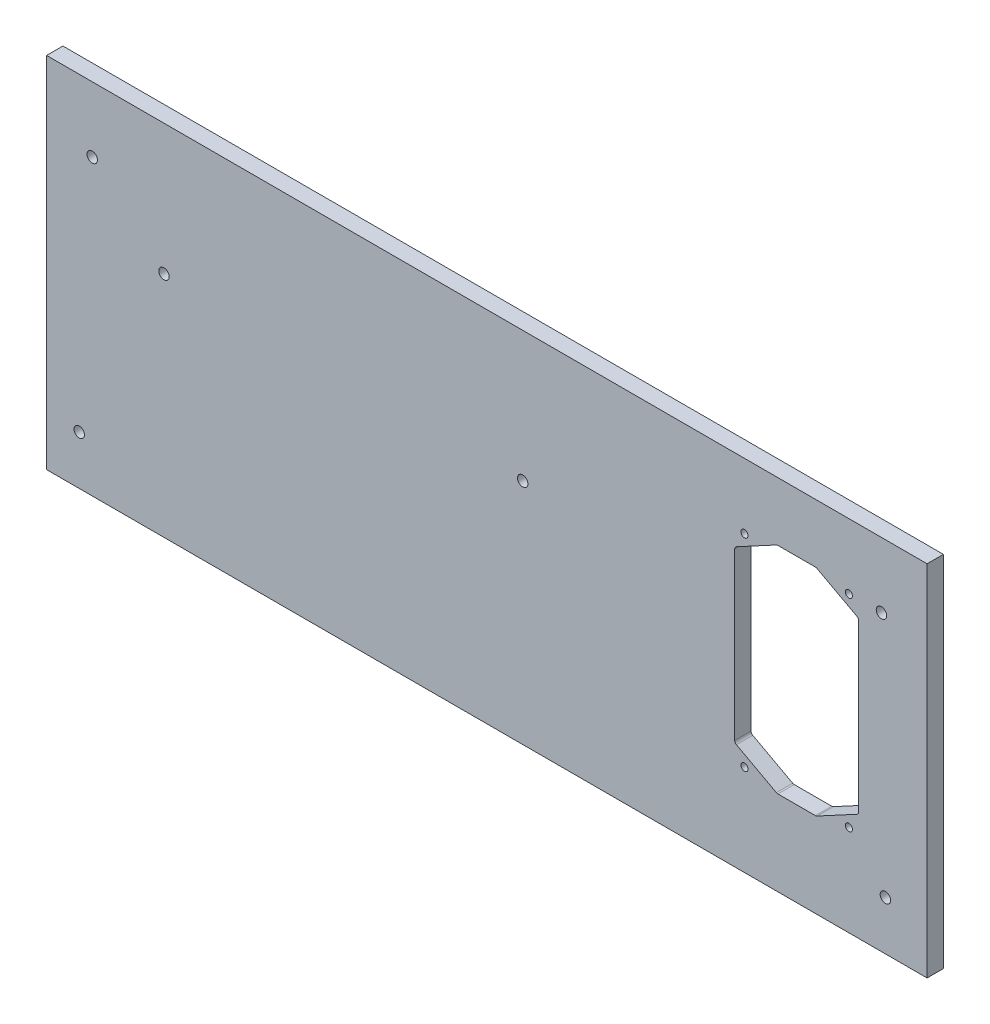
from build123d import *

# Parameters (mm, degrees)
SKETCH1_W                             = 270
SKETCH1_H                             = 110
SHEET_DEPTH                           = 2.5
SKETCH4_R                             = 1.1
CUT_EXTRUDE1_DEPTH                    = 146.859521458
FILLET1_R                             = 1
F_3_2_3_2_MOUNTHOLES_D                = 3.2
F_3_2_3_2_MOUNTHOLES_CSINK_D          = 6.5
F_3_2_3_2_MOUNTHOLES_CSINK_ANGLE      = 90
F_3_2_3_2_MIDDLEPARTHOLES_D           = 3.2
F_3_2_3_2_MIDDLEPARTHOLES_CSINK_D     = 6.5
F_3_2_3_2_MIDDLEPARTHOLES_CSINK_ANGLE = 90


with BuildPart() as part:
    # Sketch1 → Sheet (new, symmetric)
    with BuildSketch(Plane.XY):
        Rectangle(SKETCH1_W, SKETCH1_H)
    extrude(amount=SHEET_DEPTH, both=True)

    # Sketch4 → Cut-Extrude1 (cut, through all)
    with BuildSketch(Plane(origin=(0, 0, -2.5), x_dir=(-1, 0, 0), z_dir=(0, 0, -1))):
        with Locations((-79, 35)):
            Circle(SKETCH4_R)
        with Locations((-111, 35)):
            Circle(SKETCH4_R)
        with Locations((-111, -27)):
            Circle(SKETCH4_R)
        with Locations((-79, -27)):
            Circle(SKETCH4_R)
        Polygon((-101, 37), (-114, 30), (-114, -22), (-101, -29), (-89, -29), (-76, -22), (-76, 30), (-89, 37), align=None)
    extrude(amount=-CUT_EXTRUDE1_DEPTH, mode=Mode.SUBTRACT)

    # Fillet1
    fillet1_edges = [part.edges().sort_by_distance(p)[0] for p in [
        (76, 30, 0),
        (89, -29, 0),
        (101, -29, 0),
        (114, -22, 0),
        (114, 30, 0),
        (101, 37, 0),
        (89, 37, 0),
        (76, -22, 0),
    ]]
    fillet(fillet1_edges, radius=FILLET1_R)

    # Ø3.2 (3.2) MountHoles (through all)
    with Locations(Plane(origin=(0, 0, -2.5), x_dir=(-1, 0, 0), z_dir=(0, 0, -1))):
        with Locations((-121, 35), (-122.21675296, -40), (125, -40), (121, 35)):
            CounterSinkHole(F_3_2_3_2_MOUNTHOLES_D / 2, F_3_2_3_2_MOUNTHOLES_CSINK_D / 2, counter_sink_angle=F_3_2_3_2_MOUNTHOLES_CSINK_ANGLE)

    # Ø3.2 (3.2) MiddlePartHoles (through all)
    with Locations(Plane(origin=(0, 0, -2.5), x_dir=(-1, 0, 0), z_dir=(0, 0, -1))):
        with Locations((-11, 15), (99, 15)):
            CounterSinkHole(F_3_2_3_2_MIDDLEPARTHOLES_D / 2, F_3_2_3_2_MIDDLEPARTHOLES_CSINK_D / 2, counter_sink_angle=F_3_2_3_2_MIDDLEPARTHOLES_CSINK_ANGLE)


solid = part.part
